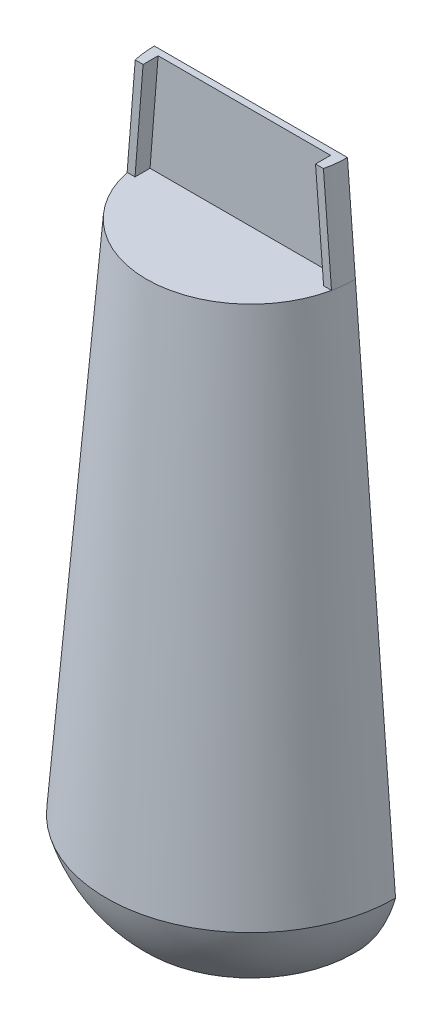
from build123d import *

# Parameters (mm, degrees)
REVOLVE1_ANGLE = 180


with BuildPart() as part:
    # Sketch1 → Revolve1 (revolve)
    with BuildSketch(Plane.XY):
        with BuildLine():
            Line((27.686, 0), (22.606, 0))
            Line((22.606, 0), (22.606, 1.8288))
            add(Edge.make_bspline(
                [(22.606, 1.8288), (25.041168082, 1.8288), (27.106875675, 2.820982452), (28.829, 4.191)],
                knots=[0, 0, 0, 0, 0.286842678, 0.286842678, 0.286842678, 0.286842678], degree=3))
            Line((28.829, 4.191), (22.606, 4.191))
            Line((22.606, 4.191), (22.606, 5.8928))
            Line((22.606, 5.8928), (30.607, 5.8928))
            add(Edge.make_bspline(
                [(30.607, 5.8928), (33.141617237, 8.764866731), (34.785171834, 12.709901725), (35.859788843, 16.222586258)],
                knots=[0.392904056, 0.392904056, 0.392904056, 0.392904056, 0.881974497, 0.881974497, 0.881974497, 0.881974497], degree=3))
            Line((35.859788843, 16.222586258), (0, 16.222586258))
            Line((0, 16.222586258), (0, 185.547))
            Line((0, 185.547), (26.0985, 185.547))
            Line((26.0985, 185.547), (39.0906, 18.669))
            add(Edge.make_bspline(
                [(27.686, 0), (33.049868002, 5.001887832), (36.872104374, 11.202594013), (39.0906, 18.669)],
                knots=[0, 0, 0, 0, 1, 1, 1, 1], degree=3))
        make_face()
    revolve(axis=Axis((0, 16.222586258, 0), (0, -1, 0)), revolution_arc=REVOLVE1_ANGLE)

    # Sketch2 for Cut-Loft1 → Cut-Loft1 section 0
    with BuildSketch(Plane(origin=(0, 185.547, 0), x_dir=(1, 0, 0), z_dir=(0, 1, 0))):
        with BuildLine():
            Line((-23.3045, -1.778), (23.3045, -1.778))
            Line((23.3045, -1.778), (23.3045, -5.842))
            Line((23.3045, -5.842), (25.43624851, -5.842))
            Line((25.43624851, -5.842), (28.03631071, -5.842))
            # circular arc as an exact rational Bezier (weights 1, cos(half-angle), 1)
            Bezier((28.03631071, -5.842), (0, -140.390907609), (-28.03631071, -5.842), weights=[1, 0.203991131, 1])
            Line((-28.03631071, -5.842), (-25.43624851, -5.842))
            Line((-25.43624851, -5.842), (-23.3045, -5.842))
            Line((-23.3045, -5.842), (-23.3045, -1.778))
        make_face()
    # Sketch4 for Cut-Loft1 → Cut-Loft1 section 1
    with BuildSketch(Plane(origin=(0, 158.115, 0), x_dir=(1, 0, 0), z_dir=(0, 1, 0))):
        with BuildLine():
            Line((-25.491437213, -1.778), (25.491437213, -1.778))
            Line((25.491437213, -1.778), (25.491437213, -5.842))
            Line((25.491437213, -5.842), (27.623185722, -5.842))
            Line((27.623185722, -5.842), (30.214593541, -5.842))
            Bezier((30.214593541, -5.842), (0, -162.110685865), (-30.214593541, -5.842), weights=[1, 0.189834418, 1])
            Line((-30.214593541, -5.842), (-27.623185722, -5.842))
            Line((-27.623185722, -5.842), (-25.491437213, -5.842))
            Line((-25.491437213, -5.842), (-25.491437213, -1.778))
        make_face()
    loft(mode=Mode.SUBTRACT)


solid = part.part
